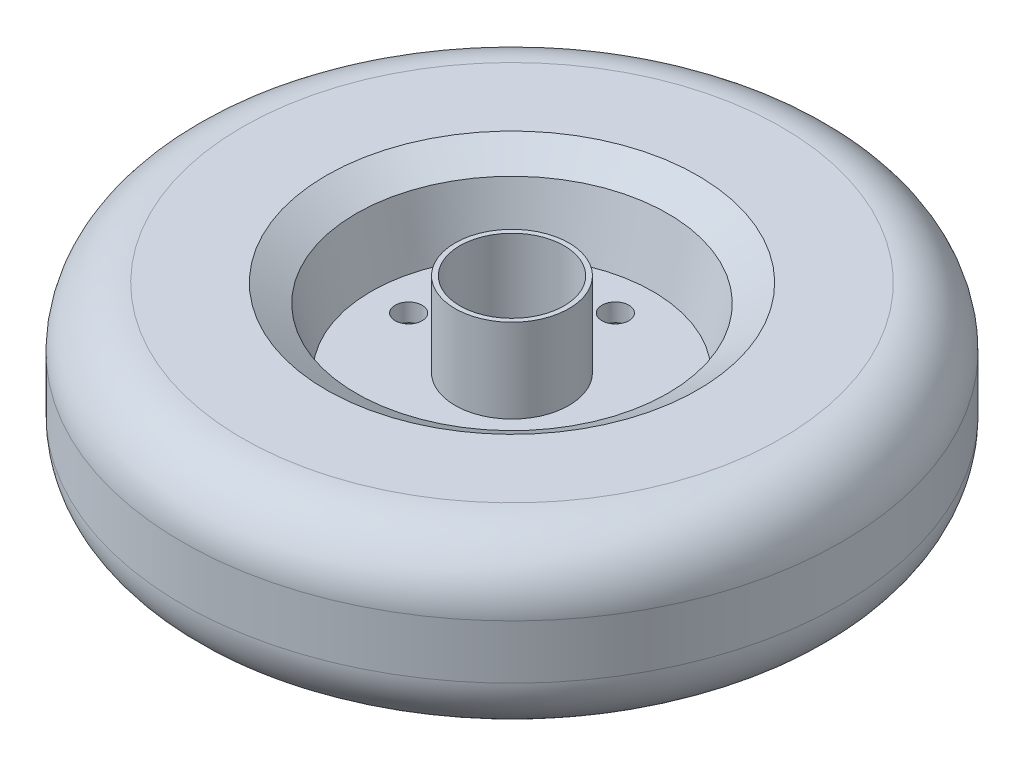
from build123d import *

# Parameters (mm, degrees)
TALADRO_DE_MARGEN_PARA_M101_D = 11
TALADRO_DE_MARGEN_PARA_M81_D  = 9
MATRIZC1_COUNT                = 4
CROQUIS8_R                    = 17.4
CORTAR_EXTRUIR2_DEPTH         = 50


with BuildPart() as part:
    # Croquis2 → Revolución1 (revolve)
    with BuildSketch(Plane.XY):
        with BuildLine():
            Line((19, 31), (0, 31))
            Line((0, 31), (0, -31))
            Line((0, -31), (19, -31))
            Line((19, -31), (19, -3))
            Line((19, -3), (47, -3))
            Line((47, -3), (52, -23))
            Line((52, -23), (62, -29))
            Line((62, -29), (90, -29))
            ThreePointArc((90, -29), (104.142135624, -23.142135624), (110, -9))
            Line((110, -9), (110, 9))
            ThreePointArc((110, 9), (104.142135624, 23.142135624), (90, 29))
            Line((90, 29), (62, 29))
            Line((62, 29), (52, 23))
            Line((52, 23), (47, 3))
            Line((47, 3), (19, 3))
            Line((19, 3), (19, 31))
        make_face()
    revolve(axis=Axis((0, 64.768346902, 0), (0, -1, 0)))

    # Taladro de margen para M101 (through all)
    with Locations(Plane(origin=(0, 31, 0), x_dir=(1, 0, 0), z_dir=(0, 1, 0))):
        with Locations((0, 0)):
            Hole(TALADRO_DE_MARGEN_PARA_M101_D / 2)

    # Taladro de margen para M81 (through all)
    with Locations(Plane(origin=(0, 3, 0), x_dir=(1, 0, 0), z_dir=(0, 1, 0))):
        with Locations((0, 34.5)):
            taladro_de_margen_para_m81 = Hole(TALADRO_DE_MARGEN_PARA_M81_D / 2)

    # MatrizC1: Taladro de margen para M81 ×4 about axis
    matrizc1_axis = Axis((0, 3, 0), (0, 1, 0))
    for i in range(1, MATRIZC1_COUNT):
        add(taladro_de_margen_para_m81.rotate(matrizc1_axis, i * 360 / MATRIZC1_COUNT), mode=Mode.SUBTRACT)

    # Croquis8 → Cortar-Extruir2 (cut)
    with BuildSketch(Plane(origin=(0, 31, 0), x_dir=(1, 0, 0), z_dir=(0, 1, 0))):
        Circle(CROQUIS8_R)
    extrude(amount=-CORTAR_EXTRUIR2_DEPTH, mode=Mode.SUBTRACT)


solid = part.part
